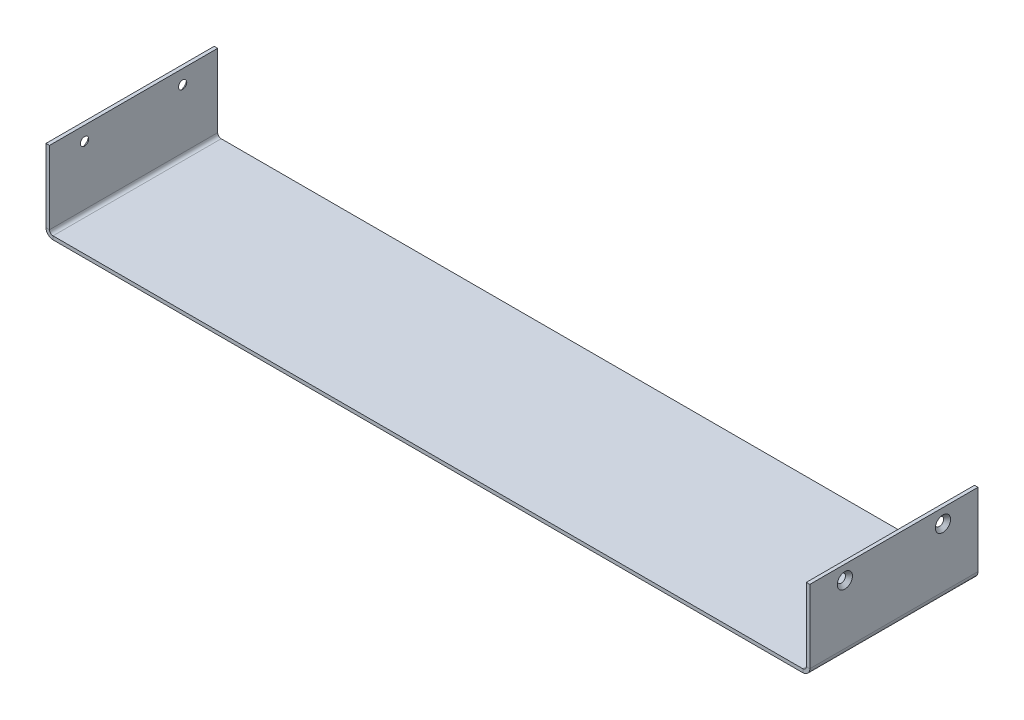
from build123d import *

# Parameters (mm, degrees)
SM_BASE_FLANGE_1_DEPTH = 96
SKETCH_2_R             = 2.3
CUT_EXTRUDE_1_DEPTH    = 449.776659375
CHAMFER_1_SIZE         = 2.05


# Sheet-metal steps are written as plain solids
with BuildPart() as part:
    # Sketch 1 → Базовая кромка1 (new body)
    with BuildSketch(Plane.XY):
        with BuildLine():
            Line((0, 0), (0, -41.7))
            ThreePointArc((0, -41.7), (1.171572875, -44.528427125), (4, -45.7))
            Line((4, -45.7), (432, -45.7))
            ThreePointArc((432, -45.7), (434.828427125, -44.528427125), (436, -41.7))
            Line((436, -41.7), (436, 0))
            Line((436, 0), (434, 0))
            Line((434, 0), (434, -41.7))
            ThreePointArc((434, -41.7), (433.414213562, -43.114213562), (432, -43.7))
            Line((432, -43.7), (4, -43.7))
            ThreePointArc((4, -43.7), (2.585786438, -43.114213562), (2, -41.7))
            Line((2, -41.7), (2, 0))
            Line((2, 0), (0, 0))
        make_face()
    extrude(amount=SM_BASE_FLANGE_1_DEPTH)

    # Sketch 2 → Вырез-Вытянуть1 (cut, through all)
    with BuildSketch(Plane.ZY):
        with Locations(Location((20, -8, 0), (0, 0, 270))):
            Circle(SKETCH_2_R)
        with Locations(Location((76, -8, 0), (0, 0, 270))):
            Circle(SKETCH_2_R)
    extrude(amount=-CUT_EXTRUDE_1_DEPTH, mode=Mode.SUBTRACT)

    # Фаска1
    # the kernel refuses this chamfer: 2.05 mm, written as the material it takes off along each edge
    with BuildSketch(Plane(origin=(436, -8, 20), x_dir=(0, -1, 0), z_dir=(0, 0, -1))) as chamfer_1_piece_1:
        Polygon((2.3 + CHAMFER_1_SIZE, 0), (2.3, CHAMFER_1_SIZE), (2.3, 0), align=None)
    revolve(axis=Axis((436, -8, 20), (-1, 0, 0)), mode=Mode.SUBTRACT)
    with BuildSketch(Plane(origin=(436, -8, 76), x_dir=(0, -1, 0), z_dir=(0, 0, -1))) as chamfer_1_piece_2:
        Polygon((2.3 + CHAMFER_1_SIZE, 0), (2.3, CHAMFER_1_SIZE), (2.3, 0), align=None)
    revolve(axis=Axis((436, -8, 76), (-1, 0, 0)), mode=Mode.SUBTRACT)
    with BuildSketch(Plane(origin=(0, -8, 76), x_dir=(0, -1, 0), z_dir=(0, 0, -1))) as chamfer_1_piece_3:
        Polygon((2.3, -CHAMFER_1_SIZE), (2.3 + CHAMFER_1_SIZE, 0), (2.3, 0), align=None)
    revolve(axis=Axis((0, -8, 76), (-1, 0, 0)), mode=Mode.SUBTRACT)
    with BuildSketch(Plane(origin=(0, -8, 20), x_dir=(0, -1, 0), z_dir=(0, 0, -1))) as chamfer_1_piece_4:
        Polygon((2.3, -CHAMFER_1_SIZE), (2.3 + CHAMFER_1_SIZE, 0), (2.3, 0), align=None)
    revolve(axis=Axis((0, -8, 20), (-1, 0, 0)), mode=Mode.SUBTRACT)


solid = part.part
